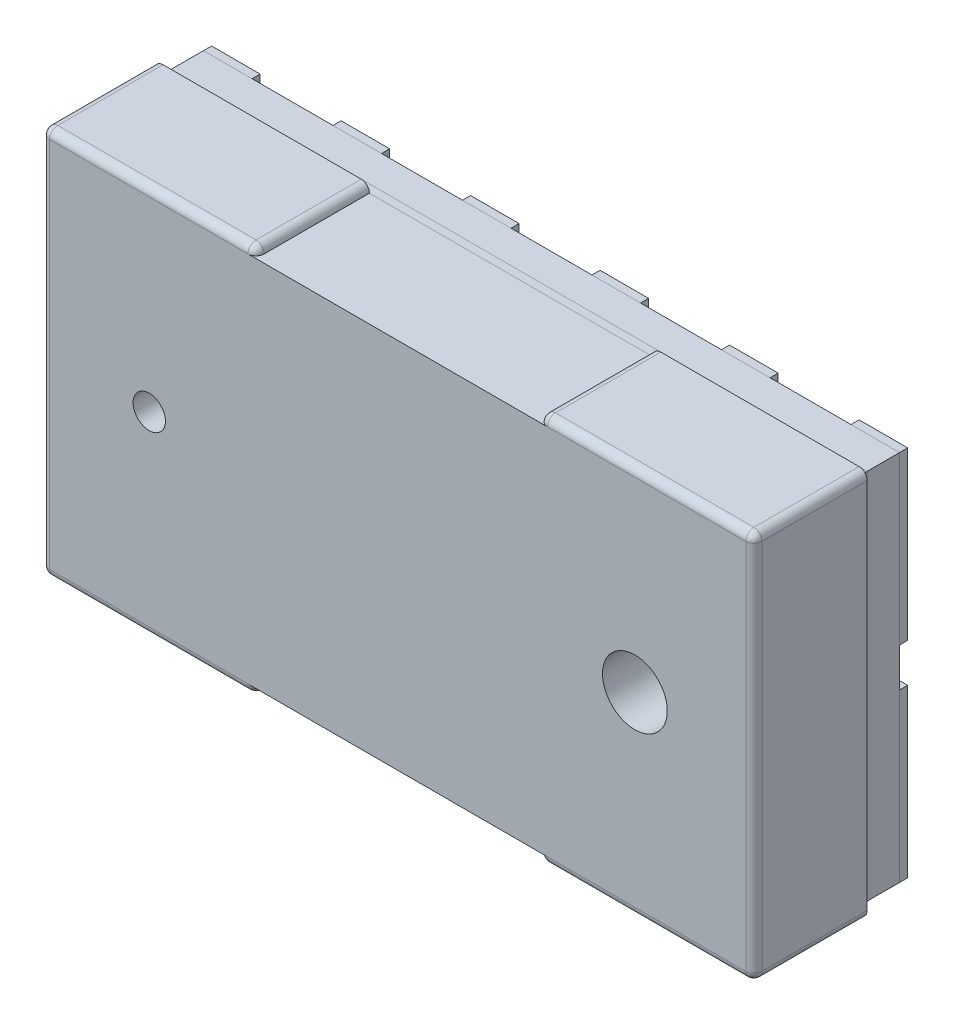
from build123d import *

# Parameters (mm, degrees)
SKETCH1_W              = 4.3
SKETCH1_H              = 2.3
BOSS_EXTRUDE1_DEPTH    = 0.05
SKETCH2_W              = 4.3
SKETCH2_H              = 2.3
BOSS_EXTRUDE2_DEPTH    = 0.2
SKETCH3_W              = 4.3
SKETCH3_H              = 2.3
BOSS_EXTRUDE3_DEPTH    = 0.05
SKETCH4_W              = 4.4
SKETCH4_H              = 2.4
BOSS_EXTRUDE4_DEPTH    = 0.7
FILLET3_R              = 0.05
SKETCH6_W              = 1.75
SKETCH6_H              = 0.1
CUT_EXTRUDE1_DEPTH     = 0.7
FILLET1_R              = 0.05
SKETCH7_R              = 0.1
SKETCH7_R_2            = 0.2
CUT_EXTRUDE2_DEPTH     = 0.7
SKETCH9_W              = 0.5
SKETCH9_H              = 0.6
SKETCH9_H_2            = 0.5
SKETCH9_W_2            = 0.1
SKETCH9_H_3            = 0.24
CUT_EXTRUDE3_DEPTH     = 3.698147513
SKETCH8_W              = 0.5
SKETCH8_H              = 0.5
BOSS_EXTRUDE5_DEPTH    = 0.05
BOSS_EXTRUDE5_2_DEPTH  = 0.05
BOSS_EXTRUDE5_3_DEPTH  = 0.05
BOSS_EXTRUDE5_4_DEPTH  = 0.05
BOSS_EXTRUDE5_5_DEPTH  = 0.05
BOSS_EXTRUDE5_6_DEPTH  = 0.05
BOSS_EXTRUDE5_7_DEPTH  = 0.05
BOSS_EXTRUDE5_8_DEPTH  = 0.05
BOSS_EXTRUDE5_9_DEPTH  = 0.05
BOSS_EXTRUDE5_10_DEPTH = 0.05
BOSS_EXTRUDE5_11_DEPTH = 0.05
BOSS_EXTRUDE5_12_DEPTH = 0.05


with BuildPart() as part:
    # Sketch1 → Boss-Extrude1 (new body)
    with BuildSketch(Plane.XY):
        Rectangle(SKETCH1_W, SKETCH1_H)
    extrude(amount=BOSS_EXTRUDE1_DEPTH)

    # Sketch9 → Cut-Extrude3 (cut, through all)
    with BuildSketch(Plane(origin=(0, 0, 0), x_dir=(-1, 0, 0), z_dir=(0, 0, -1))):
        with Locations((-1.6, 0.85)):
            Rectangle(SKETCH9_W, SKETCH9_H)
        with Locations((-0.8, 0.85)):
            Rectangle(SKETCH9_W, SKETCH9_H)
        with Locations((0, 0.85)):
            Rectangle(SKETCH9_W, SKETCH9_H)
        with Locations((0.8, 0.85)):
            Rectangle(SKETCH9_W, SKETCH9_H)
        with Locations((1.6, 0.85)):
            Rectangle(SKETCH9_W, SKETCH9_H)
        Polygon((-1.85, -0.55), (-1.35, -0.55), (-1.35, -1.15), (-1.85, -1.15), (-1.85, -0.8), (-1.93, -0.8), (-1.93, -0.55), align=None)
        with Locations((-0.8, -0.85)):
            Rectangle(SKETCH9_W, SKETCH9_H)
        with Locations((0, -0.85)):
            Rectangle(SKETCH9_W, SKETCH9_H)
        with Locations((0.8, -0.85)):
            Rectangle(SKETCH9_W, SKETCH9_H)
        with Locations((1.6, -0.85)):
            Rectangle(SKETCH9_W, SKETCH9_H)
        with Locations((-1.6, 0)):
            Rectangle(SKETCH9_W, SKETCH9_H_2)
        with Locations((1.6, 0)):
            Rectangle(SKETCH9_W, SKETCH9_H_2)
        with Locations((-2.1, 0)):
            Rectangle(SKETCH9_W_2, SKETCH9_H_3)
        with Locations((2.1, 0)):
            Rectangle(SKETCH9_W_2, SKETCH9_H_3)
    extrude(amount=-CUT_EXTRUDE3_DEPTH, mode=Mode.SUBTRACT)


with BuildPart() as body_2:
    # Sketch2 → Boss-Extrude2 (new body)
    with BuildSketch(Plane.XY.offset(0.05)):
        Rectangle(SKETCH2_W, SKETCH2_H)
    extrude(amount=BOSS_EXTRUDE2_DEPTH)


with BuildPart() as body_3:
    # Sketch3 → Boss-Extrude3 (new body)
    with BuildSketch(Plane.XY.offset(0.25)):
        Rectangle(SKETCH3_W, SKETCH3_H)
    extrude(amount=BOSS_EXTRUDE3_DEPTH)


with BuildPart() as body_4:
    # Sketch4 → Boss-Extrude4 (new body)
    with BuildSketch(Plane.XY.offset(0.3)):
        Rectangle(SKETCH4_W, SKETCH4_H)
    extrude(amount=BOSS_EXTRUDE4_DEPTH)

    # Fillet3
    fillet3_edges = [body_4.edges().sort_by_distance(p)[0] for p in [
        (-2.2, 0, 1),
        (0, -1.2, 1),
        (2.2, 0, 1),
        (0, 1.2, 1),
    ]]
    fillet(fillet3_edges, radius=FILLET3_R)

    # Sketch6 → Cut-Extrude1 (cut)
    with BuildSketch(Plane.XY.offset(1)):
        with Locations((0, 1.2)):
            Rectangle(SKETCH6_W, SKETCH6_H)
        with Locations((0, -1.2)):
            Rectangle(SKETCH6_W, SKETCH6_H)
    extrude(amount=-CUT_EXTRUDE1_DEPTH, mode=Mode.SUBTRACT)

    # Fillet1
    # the kernel refuses this fillet: 0.05 mm, written as the material it takes off along each edge
    with BuildSketch(Plane(origin=(2.15, 1.15, 0.95), x_dir=(1, 0, 0), z_dir=(0, 1, 0))) as fillet1_piece_1_section:
        Polygon((0, 0), (FILLET1_R, 0), (FILLET1_R, -FILLET1_R), (0, -FILLET1_R), align=None)
    fillet1_piece_1 = extrude(amount=FILLET1_R, mode=Mode.PRIVATE)
    fillet1_piece_1 = fillet1_piece_1 - Plane(origin=(2.15, 1.15, 0.95), x_dir=(-0.7071067811865475, 0, -0.7071067811865475), z_dir=(0, 1, 0)) * Sphere(FILLET1_R, mode=Mode.PRIVATE)
    add(fillet1_piece_1, mode=Mode.SUBTRACT)
    with BuildSketch(Plane(origin=(2.15, -1.15, 0.95), x_dir=(0, -1, 0), z_dir=(1, 0, 0))) as fillet1_piece_2_section:
        Polygon((0, 0), (FILLET1_R, 0), (FILLET1_R, -FILLET1_R), (0, -FILLET1_R), align=None)
    fillet1_piece_2 = extrude(amount=FILLET1_R, mode=Mode.PRIVATE)
    fillet1_piece_2 = fillet1_piece_2 - Plane(origin=(2.15, -1.15, 0.95), x_dir=(0, 0.7071067811865475, -0.7071067811865475), z_dir=(1, 0, 0)) * Sphere(FILLET1_R, mode=Mode.PRIVATE)
    add(fillet1_piece_2, mode=Mode.SUBTRACT)
    with BuildSketch(Plane(origin=(-2.15, 1.15, 0.95), x_dir=(0, 1, 0), z_dir=(-1, 0, 0))) as fillet1_piece_3_section:
        Polygon((0, 0), (FILLET1_R, 0), (FILLET1_R, -FILLET1_R), (0, -FILLET1_R), align=None)
    fillet1_piece_3 = extrude(amount=FILLET1_R, mode=Mode.PRIVATE)
    fillet1_piece_3 = fillet1_piece_3 - Plane(origin=(-2.15, 1.15, 0.95), x_dir=(0, -0.7071067811865475, -0.7071067811865475), z_dir=(-1, 0, 0)) * Sphere(FILLET1_R, mode=Mode.PRIVATE)
    add(fillet1_piece_3, mode=Mode.SUBTRACT)
    with BuildSketch(Plane(origin=(-2.15, -1.15, 0.95), x_dir=(-1, 0, 0), z_dir=(0, -1, 0))) as fillet1_piece_4_section:
        Polygon((0, 0), (FILLET1_R, 0), (FILLET1_R, -FILLET1_R), (0, -FILLET1_R), align=None)
    fillet1_piece_4 = extrude(amount=FILLET1_R, mode=Mode.PRIVATE)
    fillet1_piece_4 = fillet1_piece_4 - Plane(origin=(-2.15, -1.15, 0.95), x_dir=(0.7071067811865475, 0, -0.7071067811865475), z_dir=(0, -1, 0)) * Sphere(FILLET1_R, mode=Mode.PRIVATE)
    add(fillet1_piece_4, mode=Mode.SUBTRACT)
    with BuildSketch(Plane(origin=(2.2, 1.2, 0.175), x_dir=(-1, 0, 0), z_dir=(0, 0, 1)), Plane(origin=(2.2, -1.2, 0.175), x_dir=(0, 1, 0), z_dir=(0, 0, 1)), Plane(origin=(0.875, -1.2, 0.175), x_dir=(1, 0, 0), z_dir=(0, 0, 1)), Plane(origin=(-0.875, -1.2, 0.95), x_dir=(-1, 0, 0), z_dir=(0, 0, -1)), Plane(origin=(-2.2, 1.2, 0.175), x_dir=(0, -1, 0), z_dir=(0, 0, 1)), Plane(origin=(0.875, 1.2, 0.175), x_dir=(0, -1, 0), z_dir=(0, 0, 1)), Plane(origin=(-2.2, -1.2, 0.175), x_dir=(1, 0, 0), z_dir=(0, 0, 1))) as fillet1_piece_5:
        with BuildLine():
            CenterArc((FILLET1_R, FILLET1_R), FILLET1_R, 180, 90)
            Line((0, FILLET1_R), (0, 0))
            Line((0, 0), (FILLET1_R, 0))
        make_face()
    extrude(amount=0.775, mode=Mode.SUBTRACT)
    with BuildSketch(Plane(origin=(-0.875, 1.2, 0.95), x_dir=(-1, 0, 0), z_dir=(0, 0, -1))) as fillet1_piece_6:
        with BuildLine():
            CenterArc((FILLET1_R, -FILLET1_R), FILLET1_R, 90, 90)
            Line((0, -FILLET1_R), (0, 0))
            Line((0, 0), (FILLET1_R, 0))
        make_face()
    extrude(amount=0.775, mode=Mode.SUBTRACT)
    with BuildSketch(Plane(origin=(0.875, -1.15, 0.95), x_dir=(0, 0, 1), z_dir=(0, 1, 0))) as fillet1_piece_7:
        with BuildLine():
            CenterArc((0.05 - FILLET1_R, FILLET1_R), FILLET1_R, 270, 90)
            Line((0.05, FILLET1_R), (0.05, 0))
            Line((0.05, 0), (0.05 - FILLET1_R, 0))
        make_face()
    revolve(axis=Axis((0.875, -1.15, 0.95), (1, 0, 0)), revolution_arc=90, mode=Mode.SUBTRACT)
    with BuildSketch(Plane(origin=(-0.875, -1.15, 0.95), x_dir=(0, 0, 1), z_dir=(0, 1, 0))) as fillet1_piece_8:
        with BuildLine():
            CenterArc((0.05 - FILLET1_R, -FILLET1_R), FILLET1_R, 360, 90)
            Line((0.05, -FILLET1_R), (0.05, 0))
            Line((0.05, 0), (0.05 - FILLET1_R, 0))
        make_face()
    revolve(axis=Axis((-0.875, -1.15, 0.95), (1, 0, 0)), revolution_arc=90, mode=Mode.SUBTRACT)
    with BuildSketch(Plane(origin=(-0.875, 1.15, 0.95), x_dir=(0, 0, 1), z_dir=(0, -1, 0))) as fillet1_piece_9:
        with BuildLine():
            CenterArc((0.05 - FILLET1_R, FILLET1_R), FILLET1_R, 270, 90)
            Line((0.05, FILLET1_R), (0.05, 0))
            Line((0.05, 0), (0.05 - FILLET1_R, 0))
        make_face()
    revolve(axis=Axis((-0.875, 1.15, 0.95), (-1, 0, 0)), revolution_arc=90, mode=Mode.SUBTRACT)
    with BuildSketch(Plane(origin=(0.875, 1.15, 0.95), x_dir=(0, 0, 1), z_dir=(0, -1, 0))) as fillet1_piece_10:
        with BuildLine():
            CenterArc((0.05 - FILLET1_R, -FILLET1_R), FILLET1_R, 0, 90)
            Line((0.05, -FILLET1_R), (0.05, 0))
            Line((0.05, 0), (0.05 - FILLET1_R, 0))
        make_face()
    revolve(axis=Axis((0.875, 1.15, 0.95), (-1, 0, 0)), revolution_arc=90, mode=Mode.SUBTRACT)

    # Sketch7 → Cut-Extrude2 (cut)
    with BuildSketch(Plane.XY.offset(1)):
        with Locations((-1.535, 0)):
            Circle(SKETCH7_R)
        with Locations((1.465, 0)):
            Circle(SKETCH7_R_2)
    extrude(amount=-CUT_EXTRUDE2_DEPTH, mode=Mode.SUBTRACT)


with BuildPart() as body_5:
    # Sketch8 → Boss-Extrude5 (new body)
    with BuildSketch(Plane(origin=(0, 0, 0), x_dir=(-1, 0, 0), z_dir=(0, 0, -1))):
        with Locations((-0.8, -0.8)):
            Rectangle(SKETCH8_W, SKETCH8_H)
    extrude(amount=-BOSS_EXTRUDE5_DEPTH)


with BuildPart() as body_6:
    # Sketch8 → Boss-Extrude5 2 (new body)
    with BuildSketch(Plane(origin=(0, 0, 0), x_dir=(-1, 0, 0), z_dir=(0, 0, -1))):
        Polygon((-1.85, -1.05), (-1.35, -1.05), (-1.35, -0.55), (-1.85, -0.55), (-1.93, -0.55), (-1.93, -0.8), (-1.85, -0.8), align=None)
    extrude(amount=-BOSS_EXTRUDE5_2_DEPTH)


with BuildPart() as body_7:
    # Sketch8 → Boss-Extrude5 3 (new body)
    with BuildSketch(Plane(origin=(0, 0, 0), x_dir=(-1, 0, 0), z_dir=(0, 0, -1))):
        with Locations((0, -0.8)):
            Rectangle(SKETCH8_W, SKETCH8_H)
    extrude(amount=-BOSS_EXTRUDE5_3_DEPTH)


with BuildPart() as body_8:
    # Sketch8 → Boss-Extrude5 4 (new body)
    with BuildSketch(Plane(origin=(0, 0, 0), x_dir=(-1, 0, 0), z_dir=(0, 0, -1))):
        with Locations((0.8, -0.8)):
            Rectangle(SKETCH8_W, SKETCH8_H)
    extrude(amount=-BOSS_EXTRUDE5_4_DEPTH)


with BuildPart() as body_9:
    # Sketch8 → Boss-Extrude5 5 (new body)
    with BuildSketch(Plane(origin=(0, 0, 0), x_dir=(-1, 0, 0), z_dir=(0, 0, -1))):
        with Locations((1.6, -0.8)):
            Rectangle(SKETCH8_W, SKETCH8_H)
    extrude(amount=-BOSS_EXTRUDE5_5_DEPTH)


with BuildPart() as body_10:
    # Sketch8 → Boss-Extrude5 6 (new body)
    with BuildSketch(Plane(origin=(0, 0, 0), x_dir=(-1, 0, 0), z_dir=(0, 0, -1))):
        with Locations((1.6, 0)):
            Rectangle(SKETCH8_W, SKETCH8_H)
    extrude(amount=-BOSS_EXTRUDE5_6_DEPTH)


with BuildPart() as body_11:
    # Sketch8 → Boss-Extrude5 7 (new body)
    with BuildSketch(Plane(origin=(0, 0, 0), x_dir=(-1, 0, 0), z_dir=(0, 0, -1))):
        with Locations((-0.8, 0.8)):
            Rectangle(SKETCH8_W, SKETCH8_H)
    extrude(amount=-BOSS_EXTRUDE5_7_DEPTH)


with BuildPart() as body_12:
    # Sketch8 → Boss-Extrude5 8 (new body)
    with BuildSketch(Plane(origin=(0, 0, 0), x_dir=(-1, 0, 0), z_dir=(0, 0, -1))):
        with Locations((0, 0.8)):
            Rectangle(SKETCH8_W, SKETCH8_H)
    extrude(amount=-BOSS_EXTRUDE5_8_DEPTH)


with BuildPart() as body_13:
    # Sketch8 → Boss-Extrude5 9 (new body)
    with BuildSketch(Plane(origin=(0, 0, 0), x_dir=(-1, 0, 0), z_dir=(0, 0, -1))):
        with Locations((0.8, 0.8)):
            Rectangle(SKETCH8_W, SKETCH8_H)
    extrude(amount=-BOSS_EXTRUDE5_9_DEPTH)


with BuildPart() as body_14:
    # Sketch8 → Boss-Extrude5 10 (new body)
    with BuildSketch(Plane(origin=(0, 0, 0), x_dir=(-1, 0, 0), z_dir=(0, 0, -1))):
        with Locations((1.6, 0.8)):
            Rectangle(SKETCH8_W, SKETCH8_H)
    extrude(amount=-BOSS_EXTRUDE5_10_DEPTH)


with BuildPart() as body_15:
    # Sketch8 → Boss-Extrude5 11 (new body)
    with BuildSketch(Plane(origin=(0, 0, 0), x_dir=(-1, 0, 0), z_dir=(0, 0, -1))):
        with Locations((-1.6, 0)):
            Rectangle(SKETCH8_W, SKETCH8_H)
    extrude(amount=-BOSS_EXTRUDE5_11_DEPTH)


with BuildPart() as body_16:
    # Sketch8 → Boss-Extrude5 12 (new body)
    with BuildSketch(Plane(origin=(0, 0, 0), x_dir=(-1, 0, 0), z_dir=(0, 0, -1))):
        with Locations((-1.6, 0.8)):
            Rectangle(SKETCH8_W, SKETCH8_H)
    extrude(amount=-BOSS_EXTRUDE5_12_DEPTH)


solid = Compound([part.part, body_2.part, body_3.part, body_4.part, body_5.part, body_6.part, body_7.part, body_8.part, body_9.part, body_10.part, body_11.part, body_12.part, body_13.part, body_14.part, body_15.part, body_16.part])
